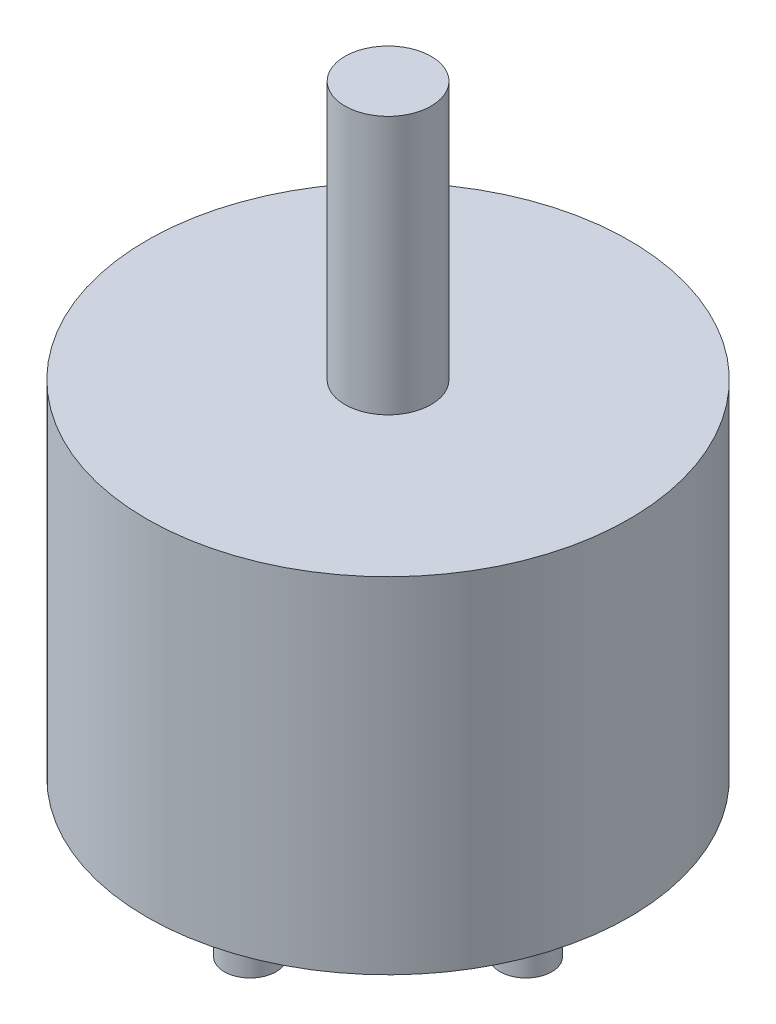
from build123d import *

# Parameters (mm, degrees)
ESQUISSE1_R        = 14
BOSS_EXTRU_1_DEPTH = 20
ESQUISSE2_R        = 2.5
BOSS_EXTRU_2_DEPTH = 15
ESQUISSE3_R        = 1.5
ESQUISSE3_R_2      = 1.438113866
BOSS_EXTRU_3_DEPTH = 5


with BuildPart() as part:
    # Esquisse1 → Boss.-Extru.1 (new body)
    with BuildSketch(Plane(origin=(0, 0, 0), x_dir=(1, 0, 0), z_dir=(0, 1, 0))):
        Circle(ESQUISSE1_R)
    extrude(amount=BOSS_EXTRU_1_DEPTH)

    # Esquisse2 → Boss.-Extru.2 (add)
    with BuildSketch(Plane(origin=(0, 20, 0), x_dir=(1, 0, 0), z_dir=(0, 1, 0))):
        Circle(ESQUISSE2_R)
    extrude(amount=BOSS_EXTRU_2_DEPTH)

    # Esquisse3 → Boss.-Extru.3 (add)
    with BuildSketch(Plane(origin=(0, 0, 0), x_dir=(-1, 0, 0), z_dir=(0, -1, 0))):
        with Locations((-8, 0)):
            Circle(ESQUISSE3_R)
        with Locations((0, 8)):
            Circle(ESQUISSE3_R)
        with Locations((8, 0)):
            Circle(ESQUISSE3_R_2)
        with Locations((0, -8)):
            Circle(ESQUISSE3_R)
    extrude(amount=BOSS_EXTRU_3_DEPTH)


solid = part.part
